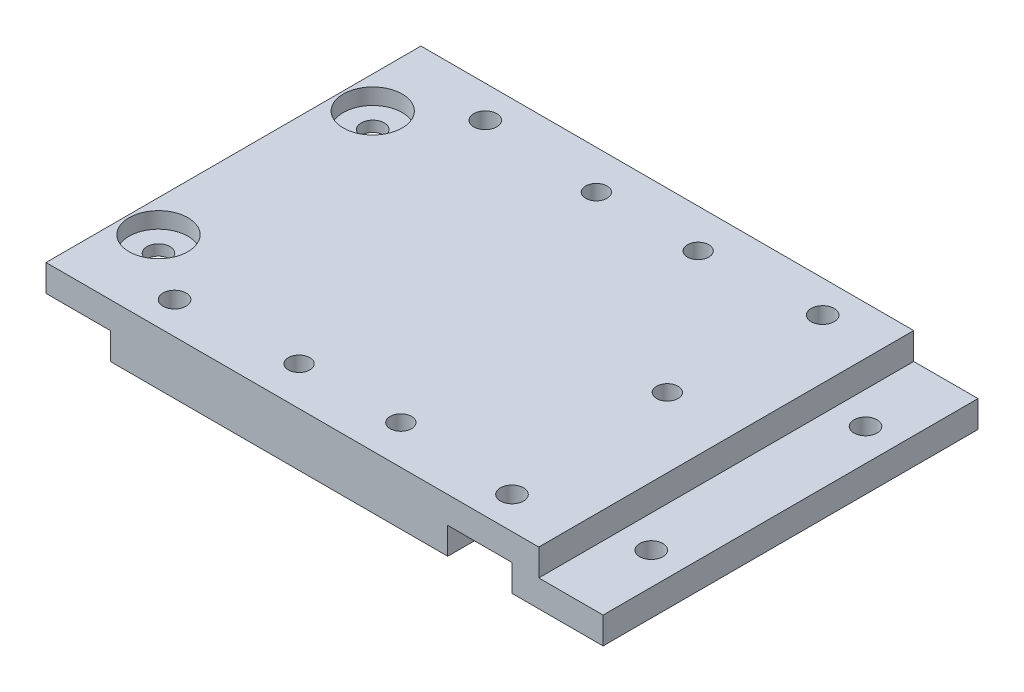
from build123d import *

# Parameters (mm, degrees)
BOSS_STRUCTURE_START                            = -40
BOSS_STRUCTURE_OUTLINE_W                        = 10
BOSS_STRUCTURE_OUTLINE_H                        = 70
BOSS_STRUCTURE_DEPTH                            = 80
SKETCH3_W                                       = 70
SKETCH3_H                                       = 5
BOSS_ATTACHE_AVANT_DEPTH                        = 12
SKETCH4_W                                       = 70
SKETCH4_H                                       = 5
BOSS_ATTACHE_ARRI_RE_DEPTH                      = 12
CBORE_FOR_6_PAN_HEAD_MACHINE_SCREW1_D           = 4.3053
CBORE_FOR_6_PAN_HEAD_MACHINE_SCREW1_CBORE_D     = 11.000000098
CBORE_FOR_6_PAN_HEAD_MACHINE_SCREW1_CBORE_DEPTH = 3.000000096
F_6_CLEARANCE_HOLE1_D                           = 4.3053
SKETCH10_W                                      = 12
SKETCH10_H                                      = 12
CUT_SUPPORT_LAT_DEPTH                           = 5
F_6_CLEARANCE_HOLE2_D                           = 4.3053
F_6_CLEARANCE_HOLE2_DEPTH                       = 10
BOARD_R                                         = 2
CUT_EXTRUDE2_DEPTH                              = 6.5


# Read off the part's stored shape, not the designer's step: Boss-Structure
with BuildPart() as part:
    # Boss-Structure outline → Boss-Structure (new body)
    with BuildSketch(Plane.YZ.offset(BOSS_STRUCTURE_START)):
        with Locations((-5, 0)):
            Rectangle(BOSS_STRUCTURE_OUTLINE_W, BOSS_STRUCTURE_OUTLINE_H)
    extrude(amount=BOSS_STRUCTURE_DEPTH)

    # Sketch3 → Boss-Attache avant (add)
    with BuildSketch(Plane.ZY.offset(40)):
        with Locations((0, -2.5)):
            Rectangle(SKETCH3_W, SKETCH3_H)
    extrude(amount=BOSS_ATTACHE_AVANT_DEPTH)

    # Sketch4 → Boss-Attache arrière (add)
    with BuildSketch(Plane(origin=(40, 0, 0), x_dir=(0, 0, -1), z_dir=(1, 0, 0))):
        with Locations((0, -7.5)):
            Rectangle(SKETCH4_W, SKETCH4_H)
    extrude(amount=BOSS_ATTACHE_ARRI_RE_DEPTH)

    # CBORE for #6 Pan Head Machine Screw1 (through all)
    with Locations(Plane(origin=(0, 0, 0), x_dir=(1, 0, 0), z_dir=(0, 1, 0))):
        with Locations((-46, 20), (-46, -20)):
            CounterBoreHole(CBORE_FOR_6_PAN_HEAD_MACHINE_SCREW1_D / 2, CBORE_FOR_6_PAN_HEAD_MACHINE_SCREW1_CBORE_D / 2, CBORE_FOR_6_PAN_HEAD_MACHINE_SCREW1_CBORE_DEPTH)

    # #6 Clearance Hole1 (through all)
    with Locations(Plane(origin=(0, -5, 0), x_dir=(1, 0, 0), z_dir=(0, 1, 0))):
        with Locations((46, 20), (46, -20)):
            Hole(F_6_CLEARANCE_HOLE1_D / 2)

    # Sketch10 → Cut-Support lat (cut)
    with BuildSketch(Plane.XZ.offset(10)):
        with Locations((29, 29)):
            Rectangle(SKETCH10_W, SKETCH10_H)
        with Locations((29, -29)):
            Rectangle(SKETCH10_W, SKETCH10_H)
    extrude(amount=-CUT_SUPPORT_LAT_DEPTH, mode=Mode.SUBTRACT)

    # #6 Clearance Hole2
    with Locations(Plane(origin=(0, 0, 0), x_dir=(1, 0, 0), z_dir=(0, 1, 0))):
        with Locations((-34, 29), (-34, -29), (29, -29), (29, 29)):
            Hole(F_6_CLEARANCE_HOLE2_D / 2, depth=F_6_CLEARANCE_HOLE2_DEPTH)

    # Board → Cut-Extrude2 (cut)
    with BuildSketch(Plane(origin=(0, 0, 0), x_dir=(1, 0, 0), z_dir=(0, 1, 0))):
        with Locations(Location((-12, 27.75, 0), (0, 0, 270))):
            Circle(BOARD_R)
        with Locations(Location((7, 27.75, 0), (0, 0, 270))):
            Circle(BOARD_R)
        with Locations(Location((-12, -27.75, 0), (0, 0, 270))):
            Circle(BOARD_R)
        with Locations(Location((7, -27.75, 0), (0, 0, 270))):
            Circle(BOARD_R)
        with Locations(Location((27, 2, 0), (0, 0, 270))):
            Circle(BOARD_R)
    extrude(amount=-CUT_EXTRUDE2_DEPTH, mode=Mode.SUBTRACT)


solid = part.part
